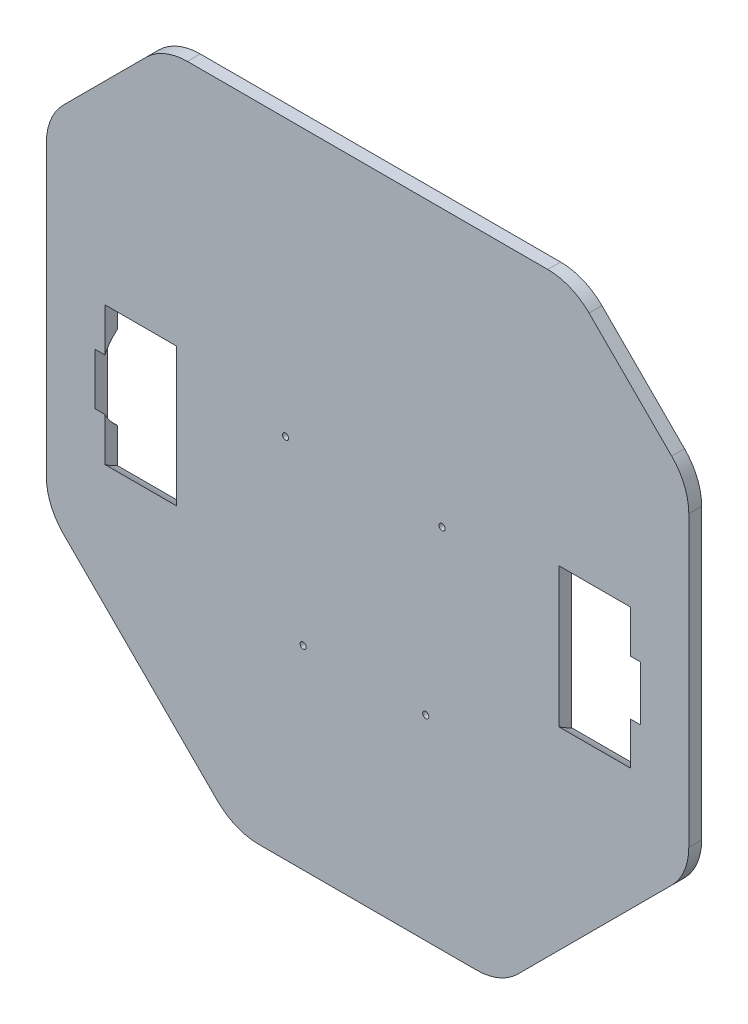
from build123d import *

# Parameters (mm, degrees)
BOSS_EXTRUDE1_DEPTH = 5.588
SKETCH3_R           = 1.3462
CUT_EXTRUDE2_DEPTH  = 5.588
CAVITY1_START       = 83.185
CAVITY1_DEPTH       = 31.115
CAVITY1_START_2     = -114.3
CAVITY1_2_DEPTH     = 31.115
CAVITY1_START_3     = 114.3
CAVITY1_3_DEPTH     = 4.318
CAVITY1_START_4     = -118.618
CAVITY1_4_DEPTH     = 4.318
CAVITY1_START_5     = 118.618
CAVITY1_5_DEPTH     = 4.8514


# Read off the part's stored shape, not the designer's step: Cavity1
with BuildPart() as part:
    # Sketch1 → Boss-Extrude1 (new body)
    with BuildSketch(Plane.XY):
        with BuildLine():
            Line((65.305122421, -132.260512242), (132.260512242, -65.305122421))
            ThreePointArc((132.260512242, -65.305122421), (137.766540126, -57.064769361), (139.7, -47.344610179))
            Line((139.7, -47.344610179), (139.7, 78.378975516))
            ThreePointArc((139.7, 78.378975516), (137.766540126, 88.099134698), (132.260512242, 96.339487758))
            Line((132.260512242, 96.339487758), (96.339487758, 132.260512242))
            ThreePointArc((96.339487758, 132.260512242), (88.099134698, 137.766540126), (78.378975516, 139.7))
            Line((78.378975516, 139.7), (-78.378975516, 139.7))
            ThreePointArc((-78.378975516, 139.7), (-88.099134698, 137.766540126), (-96.339487758, 132.260512242))
            Line((-96.339487758, 132.260512242), (-132.260512242, 96.339487758))
            ThreePointArc((-132.260512242, 96.339487758), (-137.766540126, 88.099134698), (-139.7, 78.378975516))
            Line((-139.7, 78.378975516), (-139.7, -47.344610179))
            ThreePointArc((-139.7, -47.344610179), (-137.766540126, -57.064769361), (-132.260512242, -65.305122421))
            Line((-132.260512242, -65.305122421), (-65.305122421, -132.260512242))
            ThreePointArc((-65.305122421, -132.260512242), (-57.064769361, -137.766540126), (-47.344610179, -139.7))
            Line((-47.344610179, -139.7), (47.344610179, -139.7))
            ThreePointArc((47.344610179, -139.7), (57.064769361, -137.766540126), (65.305122421, -132.260512242))
        make_face()
    extrude(amount=BOSS_EXTRUDE1_DEPTH)

    # Sketch3 → Cut-Extrude2 (cut)
    with BuildSketch(Plane(origin=(0, 0, 0), x_dir=(-1, 0, 0), z_dir=(0, 0, -1))):
        with Locations((-32.4104, 19.658336728)):
            Circle(SKETCH3_R)
        with Locations((35.687, 19.745836517)):
            Circle(SKETCH3_R)
        with Locations((28.0416, -55.144663272)):
            Circle(SKETCH3_R)
        with Locations((-25.2984, -54.636663272)):
            Circle(SKETCH3_R)
    extrude(amount=-CUT_EXTRUDE2_DEPTH, mode=Mode.SUBTRACT)

    # Cavity1 outline → Cavity1 (cut)
    with BuildSketch(Plane.YZ.offset(CAVITY1_START)):
        with BuildLine():
            ThreePointArc((-30.161375078, 5.588), (-31.865780452, 2.863110305), (-33.326130038, 0))
            Line((-33.326130038, 0), (33.689150844, 0))
            ThreePointArc((33.689150844, 0), (32.228801258, 2.863110305), (30.524395884, 5.588))
            Line((30.524395884, 5.588), (-30.161375078, 5.588))
        make_face()
    extrude(amount=CAVITY1_DEPTH, mode=Mode.SUBTRACT)

    # Cavity1 2 outline → Cavity1 2 (cut)
    with BuildSketch(Plane.YZ.offset(CAVITY1_START_2)):
        with BuildLine():
            Line((-33.347208643, 0), (33.347208643, 0))
            ThreePointArc((33.347208643, 0), (31.84705315, 2.865329857), (30.101301452, 5.588))
            Line((30.101301452, 5.588), (-30.101301452, 5.588))
            ThreePointArc((-30.101301452, 5.588), (-31.84705315, 2.865329857), (-33.347208643, 0))
        make_face()
    extrude(amount=CAVITY1_2_DEPTH, mode=Mode.SUBTRACT)

    # Cavity1 3 outline → Cavity1 3 (cut)
    with BuildSketch(Plane.YZ.offset(CAVITY1_START_3)):
        with BuildLine():
            ThreePointArc((-11.660862641, 5.588), (-15.245647335, 3.098030401), (-18.320194056, 0))
            Line((-18.320194056, 0), (18.683214863, 0))
            ThreePointArc((18.683214863, 0), (15.608668142, 3.098030401), (12.023883447, 5.588))
            Line((12.023883447, 5.588), (-11.660862641, 5.588))
        make_face()
    extrude(amount=CAVITY1_3_DEPTH, mode=Mode.SUBTRACT)

    # Cavity1 4 outline → Cavity1 4 (cut)
    with BuildSketch(Plane.YZ.offset(CAVITY1_START_4)):
        with BuildLine():
            ThreePointArc((-11.208900442, 5.588), (-14.972228516, 3.12349524), (-18.209542122, 0))
            Line((-18.209542122, 0), (18.209542122, 0))
            ThreePointArc((18.209542122, 0), (14.972228516, 3.12349524), (11.208900442, 5.588))
            Line((11.208900442, 5.588), (-11.208900442, 5.588))
        make_face()
    extrude(amount=CAVITY1_4_DEPTH, mode=Mode.SUBTRACT)

    # Cavity1 5 outline → Cavity1 5 (cut)
    with BuildSketch(Plane.YZ.offset(CAVITY1_START_5)):
        with BuildLine():
            ThreePointArc((3.456513242, 0), (0.181510403, 0.346877829), (-3.093492436, 0))
            Line((-3.093492436, 0), (3.456513242, 0))
        make_face()
    extrude(amount=CAVITY1_5_DEPTH, mode=Mode.SUBTRACT)


solid = part.part
